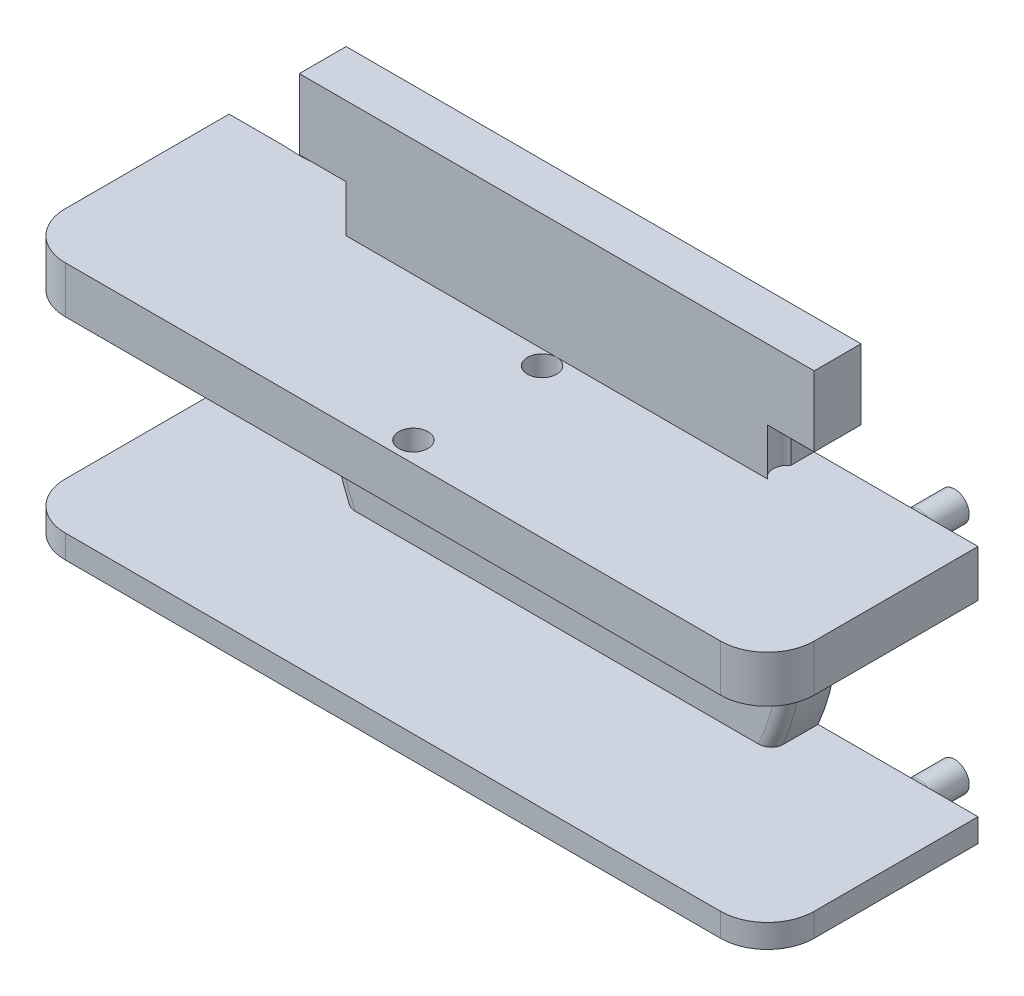
from build123d import *

# Parameters (mm, degrees)
BOSS_EXTRUDE1_DEPTH     = 2
SKETCH2_R               = 1.575
BOSS_EXTRUDE2_DEPTH     = 4
SKETCH3_R               = 1.8
BOSS_EXTRUDE3_DEPTH     = 0.85
SKETCH4_W               = 2
SKETCH4_H               = 17
BOSS_EXTRUDE4_DEPTH     = 0.001
SKETCH5_W               = 18
SKETCH5_H               = 2
BOSS_EXTRUDE5_DEPTH     = 0.001
SKETCH6_W               = 2.001
SKETCH6_H               = 2
BOSS_EXTRUDE6_DEPTH     = 5
BOSS_EXTRUDE7_DEPTH     = 0.001
CUT_EXTRUDE1_DEPTH      = 20.519323784
SKETCH9_W               = 2.937742252
SKETCH9_H               = 8
CUT_EXTRUDE2_DEPTH      = 0.001
CUT_EXTRUDE11_START     = -0.001
SKETCH21_R              = 9.75
SKETCH21_R_2            = 1.8
CUT_EXTRUDE11_DEPTH     = 0.001
SKETCH10_W              = 32
SKETCH10_H              = 2
BOSS_EXTRUDE8_DEPTH     = 7
FILLET1_R               = 0.5
SKETCH11_R              = 0.625
BOSS_EXTRUDE9_DEPTH     = 2
SKETCH14_W              = 2
SKETCH14_H              = 2
CUT_EXTRUDE5_DEPTH      = 22.401355237
SKETCH12_R              = 0.675
CUT_EXTRUDE3_DEPTH      = 2.5
CUT_EXTRUDE6_DEPTH      = 2
FILLET2_R               = 0.5
FILLET3_R               = 0.5
FILLET4_R               = 2
CUT_EXTRUDE7_DEPTH      = 26.019992106
CUT_EXTRUDE7_DEPTH_BACK = 1
SKETCH19_R              = 0.625
CUT_EXTRUDE9_DEPTH      = 2


with BuildPart() as part:
    # Sketch1 → Boss-Extrude1 (new body)
    with BuildSketch(Plane.XY):
        Polygon((-11, 6), (-11, 11), (11, 11), (11, 6), (11, -6), (-11, -6), align=None)
    extrude(amount=BOSS_EXTRUDE1_DEPTH)

    # Sketch3 → Boss-Extrude3 (add)
    with BuildSketch(Plane(origin=(0, 0, 0), x_dir=(-1, 0, 0), z_dir=(0, 0, -1))):
        with Locations(Location((0, 0, 0), (0, 0, 180))):
            Circle(SKETCH3_R)
    extrude(amount=BOSS_EXTRUDE3_DEPTH)

    # Sketch4 → Boss-Extrude4 (add)
    with BuildSketch(Plane(origin=(0, 0, 0), x_dir=(-1, 0, 0), z_dir=(0, 0, -1))):
        with Locations((10, 2.5)):
            Rectangle(SKETCH4_W, SKETCH4_H)
        with Locations((-10, 2.5)):
            Rectangle(SKETCH4_W, SKETCH4_H)
    extrude(amount=BOSS_EXTRUDE4_DEPTH)

    # Sketch5 → Boss-Extrude5 (add)
    with BuildSketch(Plane(origin=(0, 0, 0), x_dir=(-1, 0, 0), z_dir=(0, 0, -1))):
        with Locations((0, 10)):
            Rectangle(SKETCH5_W, SKETCH5_H)
    extrude(amount=BOSS_EXTRUDE5_DEPTH)

    # Sketch6 → Boss-Extrude6 (add)
    with BuildSketch(Plane(origin=(11, 0, 0), x_dir=(0, 0, -1), z_dir=(1, 0, 0))):
        with Locations((-0.9995, -5)):
            Rectangle(SKETCH6_W, SKETCH6_H)
        with Locations((-0.9995, 5)):
            Rectangle(SKETCH6_W, SKETCH6_H)
    boss_extrude6 = extrude(amount=BOSS_EXTRUDE6_DEPTH)

    # Mirror1: Boss-Extrude6 across plane
    add(boss_extrude6.mirror(Plane(origin=(0, 0, 0), x_dir=(0, 0, 1), z_dir=(1, 0, 0))))

    # Sketch7 → Boss-Extrude7 (add)
    with BuildSketch(Plane(origin=(0, 0, -0.001), x_dir=(-1, 0, 0), z_dir=(0, 0, -1))):
        with BuildLine():
            ThreePointArc((-6.708203932, -6), (-8.407551231, -3.211398808), (-9, 0))
            Line((-9, 0), (-9, -6))
            Line((-9, -6), (-6.708203932, -6))
        make_face()
        with BuildLine():
            Line((-9, 9), (-9, 0))
            ThreePointArc((-9, 0), (-6.363961031, 6.363961031), (0, 9))
            Line((0, 9), (-9, 9))
        make_face()
    boss_extrude7 = extrude(amount=-BOSS_EXTRUDE7_DEPTH)

    # Sketch8 → Cut-Extrude1 (cut, through all)
    with BuildSketch(Plane(origin=(0, 0, -0.001), x_dir=(-1, 0, 0), z_dir=(0, 0, -1))):
        with BuildLine():
            Line((-11, 4), (-9.16515139, 4))
            ThreePointArc((-9.16515139, 4), (-10, 0), (-9.16515139, -4))
            Line((-9.16515139, -4), (-11, -4))
            Line((-11, -4), (-11, 4))
        make_face()
    cut_extrude1 = extrude(amount=-CUT_EXTRUDE1_DEPTH, mode=Mode.SUBTRACT)

    # Sketch9 → Cut-Extrude2 (cut)
    with BuildSketch(Plane(origin=(0, 0, -0.001), x_dir=(-1, 0, 0), z_dir=(0, 0, -1))):
        with Locations((-9.531128874, 0)):
            Rectangle(SKETCH9_W, SKETCH9_H)
    cut_extrude2 = extrude(amount=-CUT_EXTRUDE2_DEPTH, mode=Mode.SUBTRACT)

    # Mirror2: Boss-Extrude7, Cut-Extrude1, Cut-Extrude2 across plane
    add(boss_extrude7.mirror(Plane(origin=(0, 0, 0), x_dir=(0, 0, 1), z_dir=(1, 0, 0))))
    add(cut_extrude1.mirror(Plane(origin=(0, 0, 0), x_dir=(0, 0, 1), z_dir=(1, 0, 0))), mode=Mode.SUBTRACT)
    add(cut_extrude2.mirror(Plane(origin=(0, 0, 0), x_dir=(0, 0, 1), z_dir=(1, 0, 0))), mode=Mode.SUBTRACT)

    # Sketch21 → Cut-Extrude11 (cut)
    with BuildSketch(Plane(origin=(0, 0, -0.001), x_dir=(-1, 0, 0), z_dir=(0, 0, -1)).offset(CUT_EXTRUDE11_START)):
        Circle(SKETCH21_R)
        with Locations(Location((0, 0, 0), (0, 0, 180))):
            Circle(SKETCH21_R_2, mode=Mode.SUBTRACT)
    extrude(amount=CUT_EXTRUDE11_DEPTH, mode=Mode.SUBTRACT)

    # Sketch10 → Boss-Extrude8 (add)
    with BuildSketch(Plane.XY.offset(2)):
        with Locations((0, -5)):
            Rectangle(SKETCH10_W, SKETCH10_H)
        with Locations((0, 5)):
            Rectangle(SKETCH10_W, SKETCH10_H)
    extrude(amount=BOSS_EXTRUDE8_DEPTH)

    # Fillet1
    fillet1_edges = [part.edges().sort_by_distance(p)[0] for p in [
        (10, 0, 2),
        (-10, 0, 2),
    ]]
    fillet(fillet1_edges, radius=FILLET1_R)

    # Sketch11 → Boss-Extrude9 (add)
    with BuildSketch(Plane(origin=(0, 0, -0.001), x_dir=(-1, 0, 0), z_dir=(0, 0, -1))):
        with Locations(Location((-13, -5, 0), (0, 0, 180))):
            Circle(SKETCH11_R)
    boss_extrude9 = extrude(amount=BOSS_EXTRUDE9_DEPTH)

    # Sketch14 → Cut-Extrude5 (cut, through all)
    with BuildSketch(Plane(origin=(0, 0, -0.001), x_dir=(-1, 0, 0), z_dir=(0, 0, -1))):
        with Locations((10, 7)):
            Rectangle(SKETCH14_W, SKETCH14_H)
        with Locations((-10, 7)):
            Rectangle(SKETCH14_W, SKETCH14_H)
    extrude(amount=-CUT_EXTRUDE5_DEPTH, mode=Mode.SUBTRACT)

    # Sketch12 → Cut-Extrude3 (cut)
    with BuildSketch(Plane(origin=(0, 0, -0.001), x_dir=(-1, 0, 0), z_dir=(0, 0, -1))):
        with Locations((13, -5)):
            Circle(SKETCH12_R)
    cut_extrude3 = extrude(amount=-CUT_EXTRUDE3_DEPTH, mode=Mode.SUBTRACT)

    # Sketch16 → Cut-Extrude6 (cut)
    with BuildSketch(Plane(origin=(0, 6, 0), x_dir=(1, 0, 0), z_dir=(0, 1, 0))):
        with BuildLine():
            Line((-9, -1), (-9, -2))
            ThreePointArc((-9, -2), (-8.75, -1.5), (-9, -1))
        make_face()
    cut_extrude6 = extrude(amount=CUT_EXTRUDE6_DEPTH, mode=Mode.SUBTRACT)

    # Mirror3: Boss-Extrude9, Cut-Extrude3 across plane
    add(boss_extrude9.mirror(Plane.ZX))
    add(cut_extrude3.mirror(Plane.ZX), mode=Mode.SUBTRACT)

    # Mirror4: Cut-Extrude6 across plane
    add(cut_extrude6.mirror(Plane(origin=(0, 0, 0), x_dir=(0, 0, 1), z_dir=(1, 0, 0))), mode=Mode.SUBTRACT)

    # Fillet2
    fillet2_edges = [part.edges().sort_by_distance(p)[0] for p in [
        (12.375, -5, -0.001),
        (12.375, 5, -0.001),
    ]]
    fillet(fillet2_edges, radius=FILLET2_R)

    # Fillet3
    # the kernel refuses this fillet: 0.5 mm, written as the material it takes off along each edge
    with BuildSketch(Plane(origin=(-13, -5, -0.001), x_dir=(-1, 0, 0), z_dir=(0, -1, 0))) as fillet3_piece_1:
        with BuildLine():
            CenterArc((0.675 + FILLET3_R, -FILLET3_R), FILLET3_R, 90, 90)
            Line((0.675, -FILLET3_R), (0.675, 0))
            Line((0.675, 0), (0.675 + FILLET3_R, 0))
        make_face()
    revolve(axis=Axis((-13, -5, -0.001), (0, 0, -1)), mode=Mode.SUBTRACT)
    with BuildSketch(Plane(origin=(-13, 5, -0.001), x_dir=(-1, 0, 0), z_dir=(0, 1, 0))) as fillet3_piece_2:
        with BuildLine():
            CenterArc((0.675 + FILLET3_R, FILLET3_R), FILLET3_R, 180, 90)
            Line((0.675, FILLET3_R), (0.675, 0))
            Line((0.675, 0), (0.675 + FILLET3_R, 0))
        make_face()
    revolve(axis=Axis((-13, 5, -0.001), (0, 0, 1)), mode=Mode.SUBTRACT)

    # Fillet4
    fillet4_edges = [part.edges().sort_by_distance(p)[0] for p in [
        (16, -5, 9),
        (-16, -5, 9),
        (-16, 5, 9),
        (16, 5, 9),
    ]]
    fillet(fillet4_edges, radius=FILLET4_R)

    # Sketch17 → Cut-Extrude7 (cut, two sides: drawn at the far end of the back side and taken through both)
    with BuildSketch(Plane.XZ.offset(6).offset(-CUT_EXTRUDE7_DEPTH_BACK)):
        with BuildLine():
            Line((-16, 7), (-16, -0.001))
            Line((-16, -0.001), (-14.5, -0.001))
            Line((-14.5, -0.001), (-14.5, 7))
            ThreePointArc((-14.5, 7), (-14.353553391, 7.353553391), (-14, 7.5))
            Line((-14, 7.5), (14, 7.5))
            ThreePointArc((14, 7.5), (14.353553391, 7.353553391), (14.5, 7))
            Line((14.5, 7), (14.5, -0.001))
            Line((14.5, -0.001), (16, -0.001))
            Line((16, -0.001), (16, 7))
            ThreePointArc((16, 7), (15.414213562, 8.414213562), (14, 9))
            Line((14, 9), (-14, 9))
            ThreePointArc((-14, 9), (-15.414213562, 8.414213562), (-16, 7))
        make_face()
    extrude(amount=CUT_EXTRUDE7_DEPTH + CUT_EXTRUDE7_DEPTH_BACK, mode=Mode.SUBTRACT)

    # Sketch19 → Cut-Extrude9 (cut)
    with BuildSketch(Plane(origin=(0, 6, 0), x_dir=(1, 0, 0), z_dir=(0, 1, 0))):
        with Locations(Location((0, -2.625, 0), (0, 0, 90))):
            Circle(SKETCH19_R)
        with Locations(Location((0, -8.125, 0), (0, 0, 270))):
            Circle(SKETCH19_R)
    extrude(amount=-CUT_EXTRUDE9_DEPTH, mode=Mode.SUBTRACT)


with BuildPart() as body_2:
    # Sketch2 → Boss-Extrude2 (new body)
    with BuildSketch(Plane(origin=(0, 0, 2), x_dir=(-1, 0, 0), z_dir=(0, 0, -1))):
        Circle(SKETCH2_R)
    extrude(amount=BOSS_EXTRUDE2_DEPTH)


with BuildPart() as part_1:
    add(part.part)

    # Combine2: cut body 2
    add(body_2.part, mode=Mode.SUBTRACT)


solid = part_1.part
